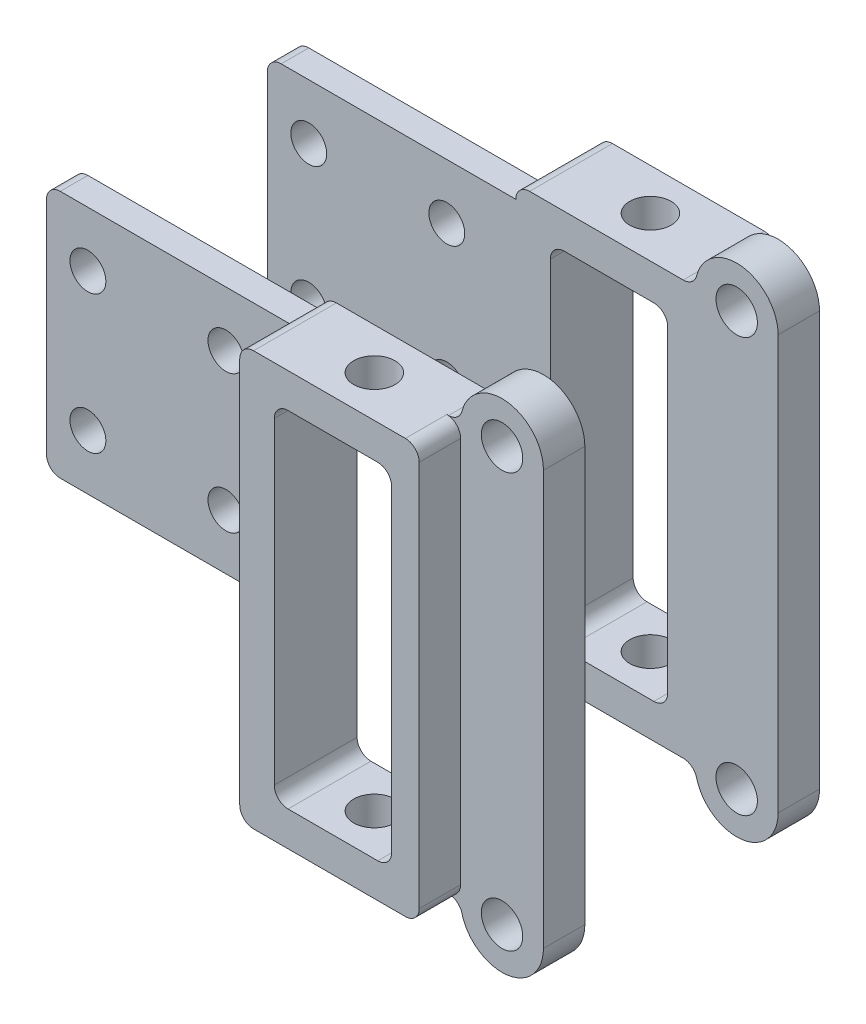
from build123d import *

# Parameters (mm, degrees)
SKETCH_2_R          = 1.5
SKETCH_2_R_2        = 1.3
EXTRUDE_1_DEPTH     = 2
SKETCH_3_R          = 1.5
EXTRUDE_2_DEPTH     = 4
SKETCH_4_W          = 8.5
SKETCH_4_H          = 25
CUT_EXTRUDE_1_DEPTH = 34
SKETCH_7_R          = 1.5
CUT_EXTRUDE_2_DEPTH = 34
CUT_EXTRUDE_START   = -3
CUT_EXTRUDE_3_DEPTH = 3
FILLET_1_R          = 1
FILLET_2_R          = 1
FILLET_3_R          = 1


with BuildPart() as part:
    # 草图2 → 凸台-拉伸1 (new body)
    with BuildSketch(Plane.XY):
        with BuildLine():
            Line((49, 10), (49, -20))
            ThreePointArc((49, -20), (46, -23), (43, -20))
            Line((43, -20), (30, -20))
            Line((30, -20), (30, -9))
            Line((30, -9), (12, -9))
            Line((12, -9), (12, 9))
            Line((12, 9), (30, 9))
            Line((30, 9), (30, 10))
            Line((30, 10), (43, 10))
            ThreePointArc((43, 10), (46, 13), (49, 10))
        make_face()
        with Locations((46, 10)):
            Circle(SKETCH_2_R, mode=Mode.SUBTRACT)
        with Locations((46, -20)):
            Circle(SKETCH_2_R, mode=Mode.SUBTRACT)
        with Locations((25, 5)):
            Circle(SKETCH_2_R_2, mode=Mode.SUBTRACT)
        with Locations((25, -5)):
            Circle(SKETCH_2_R_2, mode=Mode.SUBTRACT)
        with Locations((15, 5)):
            Circle(SKETCH_2_R_2, mode=Mode.SUBTRACT)
        with Locations((15, -5)):
            Circle(SKETCH_2_R_2, mode=Mode.SUBTRACT)
    extrude(amount=EXTRUDE_1_DEPTH)

    # 草图3 → 凸台-拉伸2 (add)
    with BuildSketch(Plane.XY.offset(2)):
        with BuildLine():
            Line((30, -20), (30, 10))
            Line((30, 10), (43, 10))
            ThreePointArc((43, 10), (46, 13), (49, 10))
            Line((49, 10), (49, -20))
            ThreePointArc((49, -20), (46, -23), (43, -20))
            Line((43, -20), (30, -20))
        make_face()
        with Locations((46, 10)):
            Circle(SKETCH_3_R, mode=Mode.SUBTRACT)
        with Locations((46, -20)):
            Circle(SKETCH_3_R, mode=Mode.SUBTRACT)
    extrude(amount=EXTRUDE_2_DEPTH)

    # 草图4 → 切除-拉伸1 (cut)
    with BuildSketch(Plane.XY.offset(6)):
        with Locations((36.75, -5)):
            Rectangle(SKETCH_4_W, SKETCH_4_H)
    extrude(amount=-CUT_EXTRUDE_1_DEPTH, mode=Mode.SUBTRACT)

    # 草图7 → 切除-拉伸2 (cut)
    with BuildSketch(Plane(origin=(0, 10, 0), x_dir=(1, 0, 0), z_dir=(0, 1, 0))):
        with Locations(Location((36.75, -3, 0), (0, 0, 270))):
            Circle(SKETCH_7_R)
    extrude(amount=-CUT_EXTRUDE_2_DEPTH, mode=Mode.SUBTRACT)

    # 草图8 → 切除-拉伸3 (cut)
    with BuildSketch(Plane.XY.offset(6).offset(CUT_EXTRUDE_START)):
        with BuildLine():
            Line((43, 10), (43, -20))
            ThreePointArc((43, -20), (46, -23), (49, -20))
            Line((49, -20), (49, 10))
            ThreePointArc((49, 10), (46, 13), (43, 10))
        make_face()
    extrude(amount=CUT_EXTRUDE_3_DEPTH, mode=Mode.SUBTRACT)

    # 圆角1
    fillet_1_edges = [part.edges().sort_by_distance(p)[0] for p in [
        (43, -20, 4.5),
        (30, -20, 3),
        (12, -9, 1),
        (12, 9, 1),
        (30, 10, 3),
        (43, 10, 4.5),
    ]]
    fillet(fillet_1_edges, radius=FILLET_1_R - 0.0001)  # a hair under: the kernel refuses the full size

    # 圆角2
    fillet_2_edges = [part.edges().sort_by_distance(p)[0] for p in [
        (43, -20, 1.5),
        (43, 10, 1.5),
    ]]
    fillet(fillet_2_edges, radius=FILLET_2_R)

    # 圆角3
    fillet_3_edges = [part.edges().sort_by_distance(p)[0] for p in [
        (32.5, -17.5, 3),
        (32.5, 7.5, 3),
        (41, 7.5, 3),
        (41, -17.5, 3),
    ]]
    fillet(fillet_3_edges, radius=FILLET_3_R)


with BuildPart() as body_2:
    # 镜向2: mirrored copy
    add(part.part.mirror(Plane(origin=(0, 0, -7), x_dir=(1, 0, 0), z_dir=(0, 0, -1))))


solid = Compound([part.part, body_2.part])
